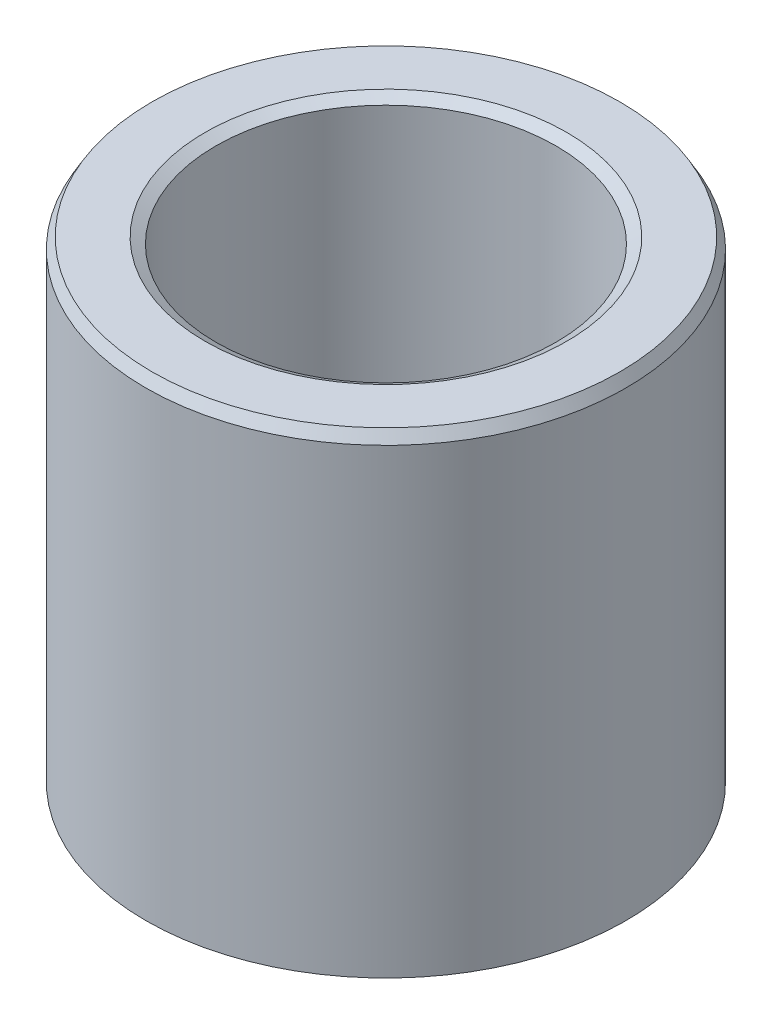
from build123d import *
from OCP.BRepFilletAPI import BRepFilletAPI_MakeChamfer

# Parameters (mm, degrees)
SKETCH1_R           = 27.5
BOSS_EXTRUDE1_DEPTH = 54.78175272
SKETCH2_R           = 19.478746735
CUT_EXTRUDE1_DEPTH  = 68.182887934
CHAMFER1_SIZE       = 1.238746479
CHAMFER1_SIZE2      = 0.715190613


with BuildPart() as part:
    # Sketch1 → Boss-Extrude1 (new body)
    with BuildSketch(Plane(origin=(0, 0, 0), x_dir=(1, 0, 0), z_dir=(0, 1, 0))):
        Circle(SKETCH1_R)
    extrude(amount=BOSS_EXTRUDE1_DEPTH)

    # Sketch2 → Cut-Extrude1 (cut, through all)
    with BuildSketch(Plane(origin=(0, 0, 0), x_dir=(1, 0, 0), z_dir=(0, 1, 0))):
        Circle(SKETCH2_R)
    extrude(amount=CUT_EXTRUDE1_DEPTH, mode=Mode.SUBTRACT)

    # Chamfer1: one chamfer whose edges measure the first distance from different faces: ONE call of the kernel's chamfer builder (chamfer() names one face for all edges)
    chamfer1_edges_1 = [part.edges().sort_by_distance(p)[0] for p in [
        (-19.478746735, 54.78175272, 0),
    ]]
    chamfer1_side_1 = [part.faces().sort_by_distance(p)[0] for p in [
        (-26.722182541, 54.78175272, 0),
    ]]
    chamfer1_edges_2 = [part.edges().sort_by_distance(p)[0] for p in [
        (-19.478746735, 0, 0),
    ]]
    chamfer1_side_2 = [part.faces().sort_by_distance(p)[0] for p in [
        (-19.478746735, 27.39087636, 0),
    ]]
    chamfer1_edges_3 = [part.edges().sort_by_distance(p)[0] for p in [
        (-27.5, 0, 0),
    ]]
    chamfer1_side_3 = [part.faces().sort_by_distance(p)[0] for p in [
        (-26.722182541, 0, 0),
    ]]
    chamfer1_edges_4 = [part.edges().sort_by_distance(p)[0] for p in [
        (-27.5, 54.78175272, 0),
    ]]
    chamfer1_side_4 = [part.faces().sort_by_distance(p)[0] for p in [
        (-27.5, 27.39087636, 0),
    ]]
    chamfer1 = BRepFilletAPI_MakeChamfer(part.part.solid().wrapped)
    for e in chamfer1_edges_1:
        chamfer1.Add(CHAMFER1_SIZE, CHAMFER1_SIZE2, e.wrapped, chamfer1_side_1[0].wrapped)  # the first distance lies on this face
    for e in chamfer1_edges_2:
        chamfer1.Add(CHAMFER1_SIZE, CHAMFER1_SIZE2, e.wrapped, chamfer1_side_2[0].wrapped)  # the first distance lies on this face
    for e in chamfer1_edges_3:
        chamfer1.Add(CHAMFER1_SIZE, CHAMFER1_SIZE2, e.wrapped, chamfer1_side_3[0].wrapped)  # the first distance lies on this face
    for e in chamfer1_edges_4:
        chamfer1.Add(CHAMFER1_SIZE, CHAMFER1_SIZE2, e.wrapped, chamfer1_side_4[0].wrapped)  # the first distance lies on this face
    add(Compound.cast(chamfer1.Shape()), mode=Mode.REPLACE)


solid = part.part
